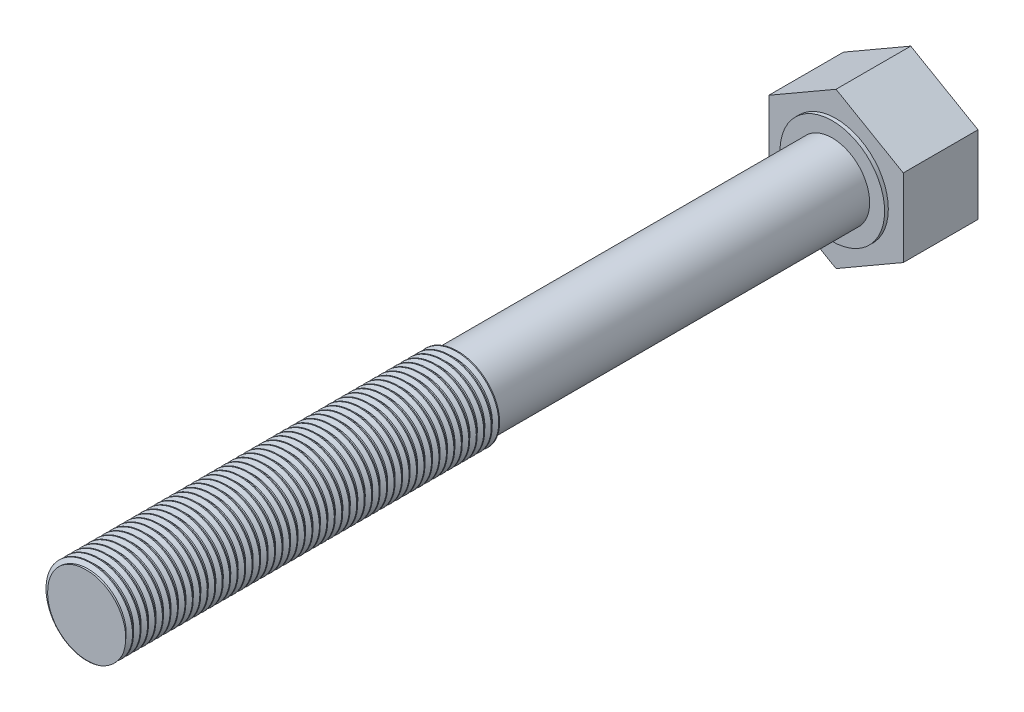
from build123d import *

# Parameters (mm, degrees)
BOSS_EXTRUDE2_DEPTH = 5
SKETCH3_R           = 3.5
BOSS_EXTRUDE3_DEPTH = 0.25
SKETCH4_R           = 2.5
BOSS_EXTRUDE4_DEPTH = 50
THREAD1_PITCH       = 0.5
SKETCH12_R          = 5
CUT_EXTRUDE1_DEPTH  = 20


with BuildPart() as part:
    # Sketch2 → Boss-Extrude2 (new body)
    with BuildSketch(Plane.XY):
        Polygon((0, 5.196152423), (-4.5, 2.598076211), (-4.5, -2.598076211), (0, -5.196152423), (4.5, -2.598076211), (4.5, 2.598076211), align=None)
    extrude(amount=-BOSS_EXTRUDE2_DEPTH)

    # Sketch3 → Boss-Extrude3 (add)
    with BuildSketch(Plane.XY):
        Circle(SKETCH3_R)
    extrude(amount=BOSS_EXTRUDE3_DEPTH)

    # Sketch4 → Boss-Extrude4 (add)
    with BuildSketch(Plane.XY.offset(0.25)):
        Circle(SKETCH4_R)
    extrude(amount=BOSS_EXTRUDE4_DEPTH)

    # Thread1: the profile of Thread Profile2 profile screwed along a right-hand helix of 60 turns, 6 arcs to a turn; built about Z, then put on its axis
    thread1_z = Axis((0, 0, 0), (0, 0, 1))
    thread1_corners = [(2.4997, 0, -0.000173205), (2.770632937, 0, 0.156249999), (2.770632937, 0, 0.218749999), (2.4997, 0, 0.375173204)]
    with BuildLine(mode=Mode.PRIVATE) as thread1_profile:
        Line(thread1_corners[0], thread1_corners[1])
        Line(thread1_corners[1], thread1_corners[2])
        Line(thread1_corners[2], thread1_corners[3])
        Line(thread1_corners[3], thread1_corners[0])
    thread1_cap = Face(thread1_profile.wire())
    thread1_turn_angles = [0, 30, 60, 90, 120, 150, 180, 210, 240, 270, 300, 330, 360, 390, 420, 450, 480, 510, 540, 570, 600, 630, 660, 690, 720]
    thread1_turn_weights = [1, 0.8660254037844387, 1, 0.8660254037844387, 1, 0.8660254037844387, 1, 0.8660254037844387, 1, 0.8660254037844387, 1, 0.8660254037844387, 1, 0.8660254037844387, 1, 0.8660254037844387, 1, 0.8660254037844387, 1, 0.8660254037844387, 1, 0.8660254037844387, 1, 0.8660254037844387, 1]
    thread1_turn_rails = [Edge.make_bspline([Vector(p[0], p[1], 0).rotate(thread1_z, thread1_turn_angles[k]) / thread1_turn_weights[k] + Vector(0, 0, p[2] + THREAD1_PITCH * thread1_turn_angles[k] / 360) for k in range(25)], [0, 0, 0, 1, 1, 2, 2, 3, 3, 4, 4, 5, 5, 6, 6, 7, 7, 8, 8, 9, 9, 10, 10, 11, 11, 12, 12, 12], 2, thread1_turn_weights) for p in thread1_corners]
    thread1_turn_sides = [Face.make_surface_from_curves(thread1_turn_rails[p[0]], thread1_turn_rails[p[1]]) for p in [(0, 1), (1, 2), (2, 3), (3, 0)]]
    thread1 = Plane(origin=(0, 0, 55.25), x_dir=(-1, 0, 0), z_dir=(0, 0, -1)) * Solid(Shell([*[p.moved(Location((0, 0, 2 * THREAD1_PITCH * i))) for i in range(30) for p in thread1_turn_sides], thread1_cap, thread1_cap.rotate(thread1_z, 21600).moved(Location((0, 0, THREAD1_PITCH * 21600 / 360)))]))
    add(thread1)

    # Sketch12 → Cut-Extrude1 (cut)
    with BuildSketch(Plane.XY.offset(50.25)):
        Circle(SKETCH12_R)
    extrude(amount=CUT_EXTRUDE1_DEPTH, mode=Mode.SUBTRACT)


solid = part.part
